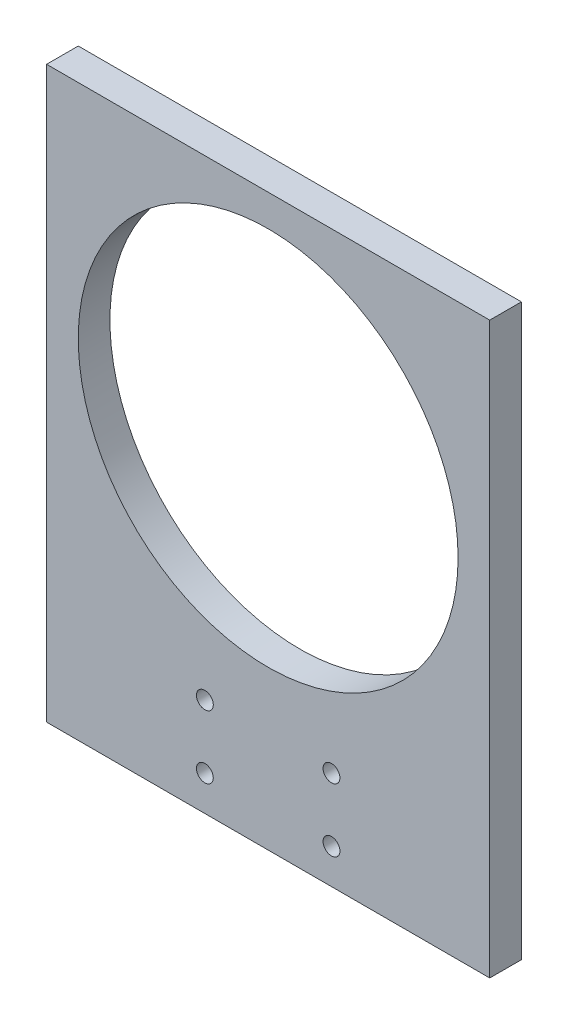
from build123d import *

# Parameters (mm, degrees)
SKETCH1_W           = 177.8
SKETCH1_H           = 228.6
SKETCH1_R           = 76.2
SKETCH1_R_2         = 3.3782
BOSS_EXTRUDE3_DEPTH = 12.7


with BuildPart() as part:
    # Sketch1 → Boss-Extrude3 (new body)
    with BuildSketch(Plane.XY):
        with Locations((88.9, 114.3)):
            Rectangle(SKETCH1_W, SKETCH1_H)
        with Locations((88.9, 139.7)):
            Circle(SKETCH1_R, mode=Mode.SUBTRACT)
        with Locations((63.5, 14.036283171)):
            Circle(SKETCH1_R_2, mode=Mode.SUBTRACT)
        with Locations((63.5, 39.436283171)):
            Circle(SKETCH1_R_2, mode=Mode.SUBTRACT)
        with Locations((114.3, 14.036283171)):
            Circle(SKETCH1_R_2, mode=Mode.SUBTRACT)
        with Locations((114.3, 39.436283171)):
            Circle(SKETCH1_R_2, mode=Mode.SUBTRACT)
    extrude(amount=BOSS_EXTRUDE3_DEPTH)


solid = part.part
